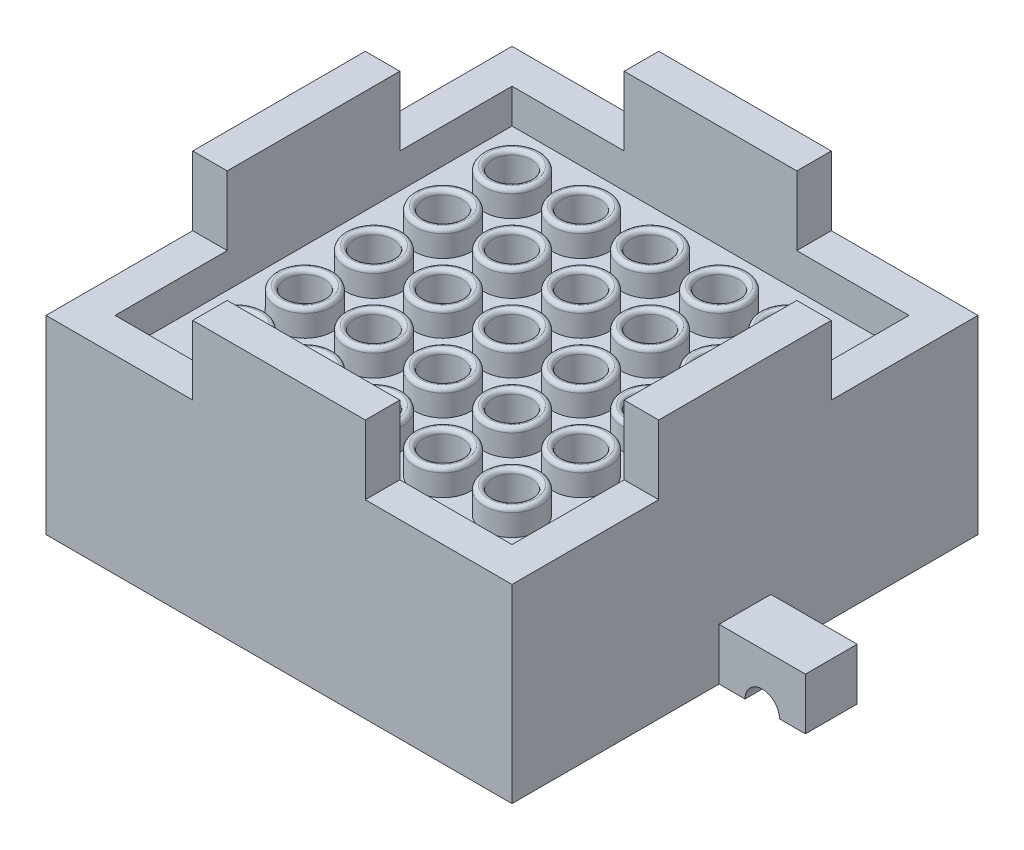
from build123d import *

# Parameters (mm, degrees)
SKETCH1_W              = 27
SKETCH1_H              = 27
SKETCH1_W_2            = 23
SKETCH1_H_2            = 23
BOSS_EXTRUDE1_DEPTH    = 2
SKETCH2_W              = 27
SKETCH2_H              = 27
BOSS_EXTRUDE2_DEPTH    = 2
SKETCH3_W              = 27
SKETCH3_H              = 27
SKETCH3_W_2            = 23
SKETCH3_H_2            = 23
BOSS_EXTRUDE3_DEPTH    = 5
SKETCH6_R              = 1.625
BOSS_EXTRUDE5_DEPTH    = 1.5
CUT_EXTRUDE2_REACH     = 22.899
SKETCH7_R              = 1.125
FILLET1_R              = 0.25
LPATTERN3_COUNT        = 5
LPATTERN3_PITCH        = 4
LPATTERN3_COUNT_DIR2   = 5
LPATTERN3_PITCH_DIR2   = 4
FILLET1_OF_LPATTERN3_R = 0.25
SKETCH11_R             = 0.75
BOSS_EXTRUDE8_DEPTH    = 5
LPATTERN2_COUNT        = 6
LPATTERN2_PITCH        = 4
LPATTERN2_COUNT_DIR2   = 6
LPATTERN2_PITCH_DIR2   = 4
SKETCH8_W              = 27
SKETCH8_H              = 27
BOSS_EXTRUDE6_DEPTH    = 2
SKETCH9_R              = 4.25
CUT_EXTRUDE3_DEPTH     = 7
SKETCH10_W             = 2
SKETCH10_H             = 10
BOSS_EXTRUDE7_DEPTH    = 4
CIRPATTERN2_COUNT      = 4
SKETCH12_W             = 3
SKETCH12_H             = 3
BOSS_EXTRUDE9_DEPTH    = 5
CUT_EXTRUDE4_START     = -3
CUT_EXTRUDE4_DEPTH     = 3
CUT_EXTRUDE4_2_DEPTH   = 3


# Read off the part's stored shape, not the designer's step: Cut-Extrude4
with BuildPart() as part:
    # Sketch1 → Boss-Extrude1 (new body)
    with BuildSketch(Plane(origin=(0, 0, 0), x_dir=(1, 0, 0), z_dir=(0, 1, 0))):
        Rectangle(SKETCH1_W, SKETCH1_H)
        Rectangle(SKETCH1_W_2, SKETCH1_H_2, mode=Mode.SUBTRACT)
    extrude(amount=BOSS_EXTRUDE1_DEPTH)

    # Sketch2 → Boss-Extrude2 (add)
    with BuildSketch(Plane.XZ):
        Rectangle(SKETCH2_W, SKETCH2_H)
    extrude(amount=BOSS_EXTRUDE2_DEPTH)

    # Sketch3 → Boss-Extrude3 (add)
    with BuildSketch(Plane.XZ.offset(2)):
        Rectangle(SKETCH3_W, SKETCH3_H)
        Rectangle(SKETCH3_W_2, SKETCH3_H_2, mode=Mode.SUBTRACT)
    extrude(amount=BOSS_EXTRUDE3_DEPTH)

    # Sketch6 → Boss-Extrude5 (add)
    with BuildSketch(Plane(origin=(0, 0, 0), x_dir=(1, 0, 0), z_dir=(0, 1, 0))):
        with Locations(Location((8, 8, 0), (0, 0, 90))):
            Circle(SKETCH6_R)
    boss_extrude5 = extrude(amount=BOSS_EXTRUDE5_DEPTH)

    # Sketch7 → Cut-Extrude2 (cut, up to next)
    with BuildSketch(Plane(origin=(0, 1.5, 0), x_dir=(1, 0, 0), z_dir=(0, 1, 0)), mode=Mode.PRIVATE) as cut_extrude2_sk1:
        with Locations(Location((8, 8, 0), (0, 0, 270))):
            Circle(SKETCH7_R)
    cut_extrude2_tool1 = extrude(cut_extrude2_sk1.sketch, amount=-CUT_EXTRUDE2_REACH, mode=Mode.PRIVATE) & part.part
    cut_extrude2 = cut_extrude2_tool1.solids().sort_by_distance((8, 1.5, -8))[0]
    add(cut_extrude2, mode=Mode.SUBTRACT)

    # Fillet1
    fillet1_edges = [part.edges().sort_by_distance(p)[0] for p in [
        (8, 1.5, -6.375),
        (8, 1.5, -9.125),
    ]]
    fillet(fillet1_edges, radius=FILLET1_R - 0.0001)  # a hair under: the kernel refuses the full size

    # LPattern3: Boss-Extrude5, Cut-Extrude2 5 × 5
    with Locations(*[(-j * LPATTERN3_PITCH_DIR2, 0, i * LPATTERN3_PITCH) for i in range(LPATTERN3_COUNT) for j in range(LPATTERN3_COUNT_DIR2) if (i, j) != (0, 0)]):
        add(boss_extrude5)
        add(cut_extrude2, mode=Mode.SUBTRACT)

    # Fillet1 of LPattern3
    fillet1_of_lpattern3_edges = [part.edges().sort_by_distance(p)[0] for p in [
        (4, 1.5, -6.375),
        (4, 1.5, -9.125),
        (0, 1.5, -6.375),
        (0, 1.5, -9.125),
        (-4, 1.5, -6.375),
        (-4, 1.5, -9.125),
        (-8, 1.5, -6.375),
        (-8, 1.5, -9.125),
        (8, 1.5, -2.375),
        (8, 1.5, -5.125),
        (4, 1.5, -2.375),
        (4, 1.5, -5.125),
        (0, 1.5, -2.375),
        (0, 1.5, -5.125),
        (-4, 1.5, -2.375),
        (-4, 1.5, -5.125),
        (-8, 1.5, -2.375),
        (-8, 1.5, -5.125),
        (8, 1.5, 1.625),
        (8, 1.5, -1.125),
        (4, 1.5, 1.625),
        (4, 1.5, -1.125),
        (0, 1.5, 1.625),
        (0, 1.5, -1.125),
        (-4, 1.5, 1.625),
        (-4, 1.5, -1.125),
        (-8, 1.5, 1.625),
        (-8, 1.5, -1.125),
        (8, 1.5, 5.625),
        (8, 1.5, 2.875),
        (4, 1.5, 5.625),
        (4, 1.5, 2.875),
        (0, 1.5, 5.625),
        (0, 1.5, 2.875),
        (-4, 1.5, 5.625),
        (-4, 1.5, 2.875),
        (-8, 1.5, 5.625),
        (-8, 1.5, 2.875),
        (8, 1.5, 9.625),
        (8, 1.5, 6.875),
        (4, 1.5, 9.625),
        (4, 1.5, 6.875),
        (0, 1.5, 9.625),
        (0, 1.5, 6.875),
        (-4, 1.5, 9.625),
        (-4, 1.5, 6.875),
        (-8, 1.5, 9.625),
        (-8, 1.5, 6.875),
    ]]
    fillet(fillet1_of_lpattern3_edges, radius=FILLET1_OF_LPATTERN3_R - 0.0001)  # a hair under: the kernel refuses the full size

    # Sketch11 → Boss-Extrude8 (add)
    with BuildSketch(Plane.XZ.offset(2)):
        with Locations(Location((-9.9, 9.9, 0), (0, 0, 90))):
            Circle(SKETCH11_R)
    boss_extrude8 = extrude(amount=BOSS_EXTRUDE8_DEPTH)

    # LPattern2: Boss-Extrude8 6 × 6
    with Locations(*[(i * LPATTERN2_PITCH, 0, -j * LPATTERN2_PITCH_DIR2) for i in range(LPATTERN2_COUNT) for j in range(LPATTERN2_COUNT_DIR2) if (i, j) != (0, 0)]):
        add(boss_extrude8)

    # Sketch8 → Boss-Extrude6 (add)
    with BuildSketch(Plane.XZ.offset(7)):
        Rectangle(SKETCH8_W, SKETCH8_H)
    extrude(amount=BOSS_EXTRUDE6_DEPTH)

    # Sketch9 → Cut-Extrude3 (cut)
    with BuildSketch(Plane.XZ.offset(9)):
        with Locations(Location((0, 0, 0), (0, 0, 270))):
            Circle(SKETCH9_R)
    extrude(amount=-CUT_EXTRUDE3_DEPTH, mode=Mode.SUBTRACT)

    # Sketch10 → Boss-Extrude7 (add)
    with BuildSketch(Plane(origin=(0, 2, 0), x_dir=(1, 0, 0), z_dir=(0, 1, 0))):
        with Locations((-12.5, 0)):
            Rectangle(SKETCH10_W, SKETCH10_H)
    boss_extrude7 = extrude(amount=BOSS_EXTRUDE7_DEPTH)

    # CirPattern2: Boss-Extrude7 ×4 about axis
    cirpattern2_axis = Axis((0, 0, 0), (0, 1, 0))
    for i in range(1, CIRPATTERN2_COUNT):
        add(boss_extrude7.rotate(cirpattern2_axis, i * 360 / CIRPATTERN2_COUNT))

    # Sketch12 → Boss-Extrude9 (add)
    with BuildSketch(Plane.ZY.offset(13.5)):
        with Locations((0, -7.5)):
            Rectangle(SKETCH12_W, SKETCH12_H)
    extrude(amount=BOSS_EXTRUDE9_DEPTH)

    # Cut-Extrude4 outline → Cut-Extrude4 (cut)
    with BuildSketch(Plane.XY.offset(1.5).offset(CUT_EXTRUDE4_START)):
        with BuildLine():
            Line((-17, -9), (-15, -9))
            ThreePointArc((-15, -9), (-16, -8), (-17, -9))
        make_face()
    extrude(amount=CUT_EXTRUDE4_DEPTH, mode=Mode.SUBTRACT)

    # Cut-Extrude4 2 outline → Cut-Extrude4 2 (add)
    with BuildSketch(Plane.XY.offset(1.5).offset(CUT_EXTRUDE4_START)):
        with BuildLine():
            Line((17, -9), (18.5, -9))
            Line((18.5, -9), (18.5, -6))
            Line((18.5, -6), (13.5, -6))
            Line((13.5, -6), (13.5, -9))
            Line((13.5, -9), (15, -9))
            ThreePointArc((15, -9), (16, -8), (17, -9))
        make_face()
    extrude(amount=CUT_EXTRUDE4_2_DEPTH)


solid = part.part
